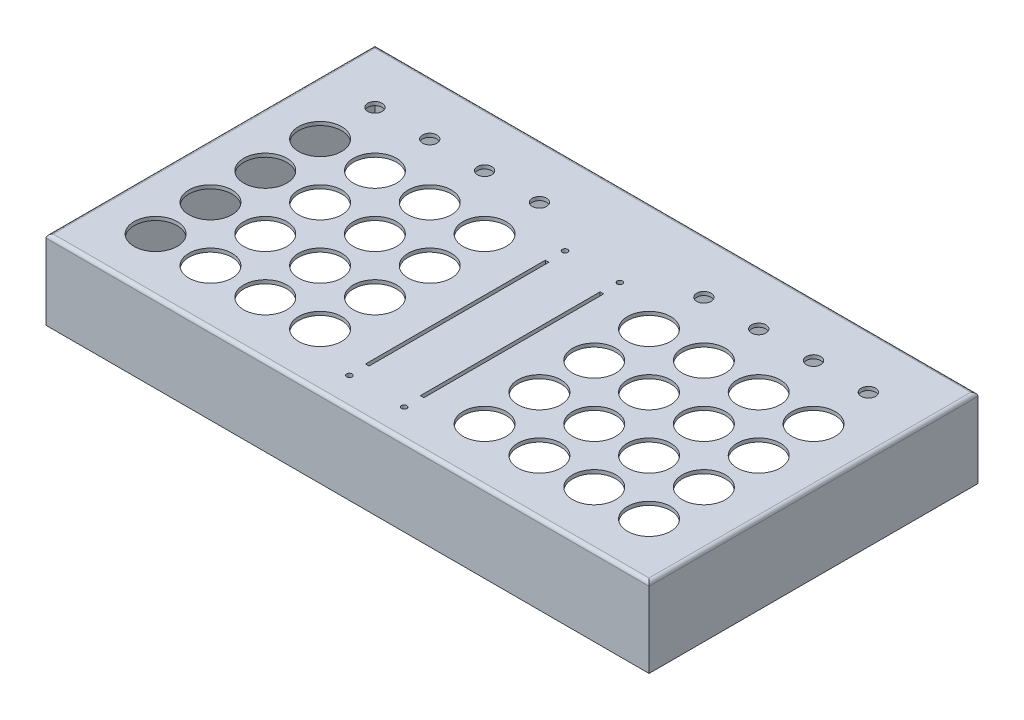
from build123d import *

# Parameters (mm, degrees)
SKETCH2_W           = 335.5
SKETCH2_H           = 183
SKETCH2_R           = 12
SKETCH2_R_2         = 1.5
SKETCH2_R_3         = 4
SKETCH2_W_2         = 2
SKETCH2_H_2         = 100
BOSS_EXTRUDE1_DEPTH = 44
SHELL1_T            = -2
FILLET1_R           = 2
SKETCH3_R           = 0.5
CUT_EXTRUDE1_DEPTH  = 1


with BuildPart() as part:
    # Sketch2 → Boss-Extrude1 (new body)
    with BuildSketch(Plane(origin=(0, 0, 0), x_dir=(1, 0, 0), z_dir=(0, 1, 0))):
        with Locations((137.25, 61)):
            Rectangle(SKETCH2_W, SKETCH2_H)
        Circle(SKETCH2_R, mode=Mode.SUBTRACT)
        with Locations((30.5, 0)):
            Circle(SKETCH2_R, mode=Mode.SUBTRACT)
        with Locations((61, 0)):
            Circle(SKETCH2_R, mode=Mode.SUBTRACT)
        with Locations((91.5, 0)):
            Circle(SKETCH2_R, mode=Mode.SUBTRACT)
        with Locations((30.5, 30.5)):
            Circle(SKETCH2_R, mode=Mode.SUBTRACT)
        with Locations((61, 30.5)):
            Circle(SKETCH2_R, mode=Mode.SUBTRACT)
        with Locations((91.5, 30.5)):
            Circle(SKETCH2_R, mode=Mode.SUBTRACT)
        with Locations((30.5, 61)):
            Circle(SKETCH2_R, mode=Mode.SUBTRACT)
        with Locations((61, 61)):
            Circle(SKETCH2_R, mode=Mode.SUBTRACT)
        with Locations((91.5, 61)):
            Circle(SKETCH2_R, mode=Mode.SUBTRACT)
        with Locations((30.5, 91.5)):
            Circle(SKETCH2_R, mode=Mode.SUBTRACT)
        with Locations((61, 91.5)):
            Circle(SKETCH2_R, mode=Mode.SUBTRACT)
        with Locations((91.5, 91.5)):
            Circle(SKETCH2_R, mode=Mode.SUBTRACT)
        with Locations((0, 30.5)):
            Circle(SKETCH2_R, mode=Mode.SUBTRACT)
        with Locations((0, 61)):
            Circle(SKETCH2_R, mode=Mode.SUBTRACT)
        with Locations((0, 91.5)):
            Circle(SKETCH2_R, mode=Mode.SUBTRACT)
        with Locations((122, 105.75)):
            Circle(SKETCH2_R_2, mode=Mode.SUBTRACT)
        with Locations((122, -14.25)):
            Circle(SKETCH2_R_2, mode=Mode.SUBTRACT)
        with Locations((0, 122)):
            Circle(SKETCH2_R_3, mode=Mode.SUBTRACT)
        with Locations((30.5, 122)):
            Circle(SKETCH2_R_3, mode=Mode.SUBTRACT)
        with Locations((61, 122)):
            Circle(SKETCH2_R_3, mode=Mode.SUBTRACT)
        with Locations((91.5, 122)):
            Circle(SKETCH2_R_3, mode=Mode.SUBTRACT)
        with Locations((183, 122)):
            Circle(SKETCH2_R_3, mode=Mode.SUBTRACT)
        with Locations((213.5, 122)):
            Circle(SKETCH2_R_3, mode=Mode.SUBTRACT)
        with Locations((244, 122)):
            Circle(SKETCH2_R_3, mode=Mode.SUBTRACT)
        with Locations((274.5, 122)):
            Circle(SKETCH2_R_3, mode=Mode.SUBTRACT)
        with Locations((152.5, -14.25)):
            Circle(SKETCH2_R_2, mode=Mode.SUBTRACT)
        with Locations((152.5, 105.75)):
            Circle(SKETCH2_R_2, mode=Mode.SUBTRACT)
        with Locations((274.5, 91.5)):
            Circle(SKETCH2_R, mode=Mode.SUBTRACT)
        with Locations((274.5, 61)):
            Circle(SKETCH2_R, mode=Mode.SUBTRACT)
        with Locations((274.5, 30.5)):
            Circle(SKETCH2_R, mode=Mode.SUBTRACT)
        with Locations((183, 91.5)):
            Circle(SKETCH2_R, mode=Mode.SUBTRACT)
        with Locations((213.5, 91.5)):
            Circle(SKETCH2_R, mode=Mode.SUBTRACT)
        with Locations((244, 91.5)):
            Circle(SKETCH2_R, mode=Mode.SUBTRACT)
        with Locations((183, 61)):
            Circle(SKETCH2_R, mode=Mode.SUBTRACT)
        with Locations((213.5, 61)):
            Circle(SKETCH2_R, mode=Mode.SUBTRACT)
        with Locations((244, 61)):
            Circle(SKETCH2_R, mode=Mode.SUBTRACT)
        with Locations((183, 30.5)):
            Circle(SKETCH2_R, mode=Mode.SUBTRACT)
        with Locations((213.5, 30.5)):
            Circle(SKETCH2_R, mode=Mode.SUBTRACT)
        with Locations((244, 30.5)):
            Circle(SKETCH2_R, mode=Mode.SUBTRACT)
        with Locations((183, 0)):
            Circle(SKETCH2_R, mode=Mode.SUBTRACT)
        with Locations((213.5, 0)):
            Circle(SKETCH2_R, mode=Mode.SUBTRACT)
        with Locations((244, 0)):
            Circle(SKETCH2_R, mode=Mode.SUBTRACT)
        with Locations((274.5, 0)):
            Circle(SKETCH2_R, mode=Mode.SUBTRACT)
        with Locations((122, 45.75)):
            Rectangle(SKETCH2_W_2, SKETCH2_H_2, mode=Mode.SUBTRACT)
        with Locations((152.5, 45.75)):
            Rectangle(SKETCH2_W_2, SKETCH2_H_2, mode=Mode.SUBTRACT)
    extrude(amount=BOSS_EXTRUDE1_DEPTH)

    # Shell1
    shell1_openings = [part.faces().sort_by_distance(p)[0] for p in [
        (137.25, 0, -65.399418493),
        (-12, 22, 0),
        (18.5, 22, 0),
        (49, 22, 0),
        (79.5, 22, 0),
        (79.5, 22, -30.5),
        (49, 22, -30.5),
        (18.5, 22, -30.5),
        (-12, 22, -30.5),
        (-12, 22, -61),
        (-12, 22, -91.5),
        (18.5, 22, -91.5),
        (18.5, 22, -61),
        (49, 22, -61),
        (49, 22, -91.5),
        (79.5, 22, -91.5),
        (79.5, 22, -61),
        (-4, 22, -122),
        (26.5, 22, -122),
        (87.5, 22, -122),
        (57, 22, -122),
        (120.5, 22, -105.75),
        (151, 22, -105.75),
        (179, 22, -122),
        (171, 22, -91.5),
        (201.5, 22, -91.5),
        (209.5, 22, -122),
        (171, 22, -61),
        (171, 22, -30.5),
        (171, 22, 0),
        (201.5, 22, 0),
        (201.5, 22, -30.5),
        (201.5, 22, -61),
        (232, 22, -61),
        (232, 22, -30.5),
        (232, 22, 0),
        (262.5, 22, 0),
        (262.5, 22, -30.5),
        (262.5, 22, -61),
        (262.5, 22, -91.5),
        (232, 22, -91.5),
        (240, 22, -122),
        (270.5, 22, -122),
        (151, 22, 14.25),
        (120.5, 22, 14.25),
        (153.5, 22, -45.75),
        (152.5, 22, -95.75),
        (122, 22, -95.75),
        (123, 22, -45.75),
        (121, 22, -45.75),
        (122, 22, 4.25),
        (151.5, 22, -45.75),
        (152.5, 22, 4.25),
    ]]
    offset(amount=SHELL1_T, openings=shell1_openings, kind=Kind.INTERSECTION)

    # Fillet1
    fillet1_edges = [part.edges().sort_by_distance(p)[0] for p in [
        (-30.5, 44, -61),
        (137.25, 44, 30.5),
        (305, 44, -61),
        (137.25, 44, -152.5),
    ]]
    fillet(fillet1_edges, radius=FILLET1_R)

    # Sketch3 → Cut-Extrude1 (cut)
    with BuildSketch(Plane.XZ.offset(-42)):
        with Locations((12, -122)):
            Circle(SKETCH3_R)
        with Locations((42.5, -122)):
            Circle(SKETCH3_R)
        with Locations((73, -122)):
            Circle(SKETCH3_R)
        with Locations((103.5, -122)):
            Circle(SKETCH3_R)
        with Locations((195, -122)):
            Circle(SKETCH3_R)
        with Locations((225.5, -122)):
            Circle(SKETCH3_R)
        with Locations((256, -122)):
            Circle(SKETCH3_R)
        with Locations((286.5, -122)):
            Circle(SKETCH3_R)
    extrude(amount=-CUT_EXTRUDE1_DEPTH, mode=Mode.SUBTRACT)


solid = part.part
